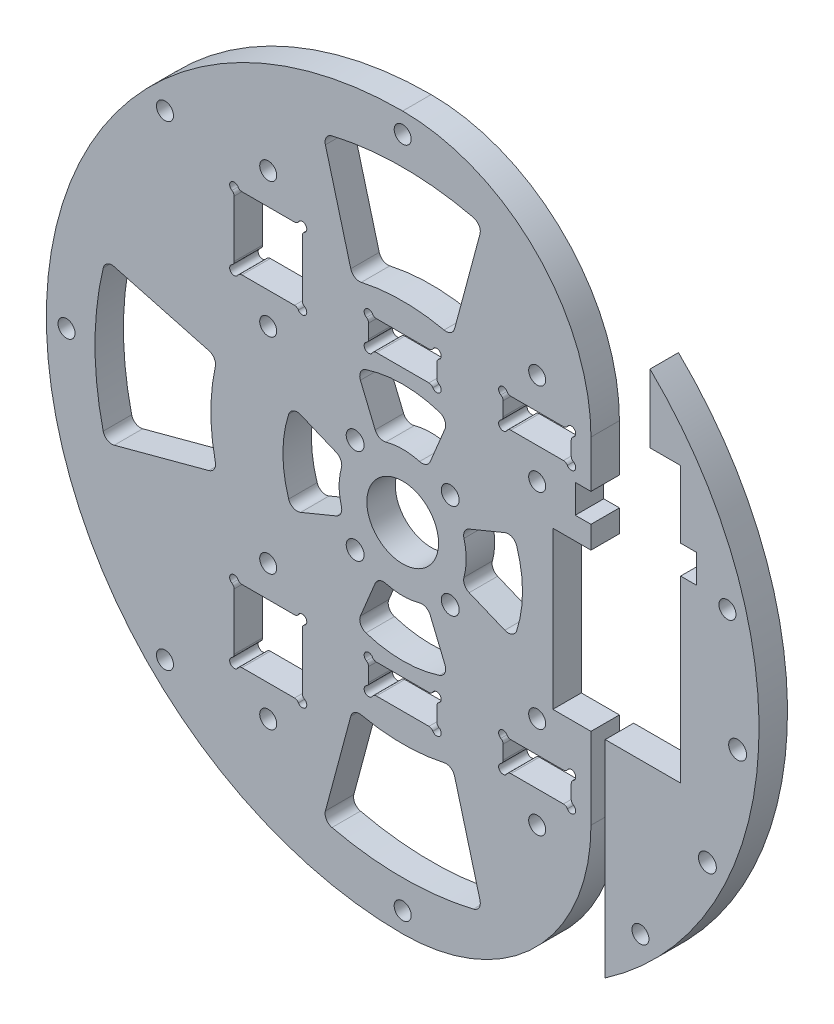
from build123d import *

# Parameters (mm, degrees)
SKETCH1_R                = 79.5
SKETCH1_R_2              = 1.9939
SKETCH1_R_3              = 1.89865
SKETCH1_R_4              = 8
BOSS_EXTRUDE1_DEPTH      = 6.35
SKETCH5_W                = 15.2
SKETCH5_H                = 16.075
CUT_EXTRUDE4_DEPTH       = 113.609158153
SKETCH6_R                = 1
CUT_EXTRUDE5_DEPTH       = 113.609158153
FILLET1_R                = 1
SKETCH10_W               = 53.523609979
SKETCH10_H               = 37.243469735
SKETCH10_W_2             = 54.285324016
SKETCH10_H_2             = 37.23416744
BOSS_EXTRUDE2_DEPTH      = 6.35
SKETCH11_W               = 15.2
SKETCH11_H               = 6.55
CUT_EXTRUDE8_DEPTH       = 113.609158153
SKETCH13_R               = 1
CUT_EXTRUDE9_DEPTH       = 113.609158153
FILLET2_R                = 1
LPATTERN3_COUNT          = 2
LPATTERN3_PITCH          = 30
FILLET2_OF_LPATTERN3_R   = 1
MIRROR3_DEPTH            = 6.35
CUT_EXTRUDE11_DEPTH      = 113.609158153
SKETCH15_W               = 6.35
SKETCH15_H               = 80
CUT_EXTRUDE12_DEPTH      = 113.609158153
CUT_EXTRUDE14_DEPTH      = 113.609158153
SKETCH17_R               = 1.89865
CUT_EXTRUDE15_DEPTH      = 113.609158153
CUT_EXTRUDE18_DEPTH      = 113.609158153
CUT_EXTRUDE19_DEPTH      = 113.609158153
FILLET4_R                = 2
CIRPATTERN1_COUNT        = 4
FILLET4_OF_CIRPATTERN1_R = 2
CUT_EXTRUDE20_DEPTH      = 113.609158153
FILLET5_R                = 2
CIRPATTERN2_COUNT        = 4
FILLET5_OF_CIRPATTERN2_R = 2


# Read off the part's stored shape, not the designer's step: Mirror3
with BuildPart() as part:
    # Sketch1 → Boss-Extrude1 (new body)
    with BuildSketch(Plane.XY):
        Circle(SKETCH1_R)
        with Locations((74.714602357, -6.536680706)):
            Circle(SKETCH1_R_2, mode=Mode.SUBTRACT)
        with Locations((72.444436972, 19.411428383)):
            Circle(SKETCH1_R_3, mode=Mode.SUBTRACT)
        Circle(SKETCH1_R_4, mode=Mode.SUBTRACT)
        with Locations((67.973084028, -31.696369631)):
            Circle(SKETCH1_R_2, mode=Mode.SUBTRACT)
        with Locations((10.606601718, -10.606601718)):
            Circle(SKETCH1_R_2, mode=Mode.SUBTRACT)
        with Locations((0, -75)):
            Circle(SKETCH1_R_3, mode=Mode.SUBTRACT)
        with Locations((-10.606601718, -10.606601718)):
            Circle(SKETCH1_R_2, mode=Mode.SUBTRACT)
        with Locations((-10.606601718, 10.606601718)):
            Circle(SKETCH1_R_2, mode=Mode.SUBTRACT)
        with Locations((10.606601718, 10.606601718)):
            Circle(SKETCH1_R_2, mode=Mode.SUBTRACT)
        with Locations((-53.033008589, -53.033008589)):
            Circle(SKETCH1_R_3, mode=Mode.SUBTRACT)
        with Locations((-75, 0)):
            Circle(SKETCH1_R_3, mode=Mode.SUBTRACT)
        with Locations((-53.033008589, 53.033008589)):
            Circle(SKETCH1_R_3, mode=Mode.SUBTRACT)
        with Locations((0, 75)):
            Circle(SKETCH1_R_3, mode=Mode.SUBTRACT)
        with Locations((53.033008589, -53.033008589)):
            Circle(SKETCH1_R_3, mode=Mode.SUBTRACT)
    extrude(amount=BOSS_EXTRUDE1_DEPTH)

    # Sketch5 → Cut-Extrude4 (cut, through all)
    with BuildSketch(Plane.XY.offset(6.35)):
        with Locations((-30, -37.9375)):
            Rectangle(SKETCH5_W, SKETCH5_H)
        with Locations((-30, 37.9375)):
            Rectangle(SKETCH5_W, SKETCH5_H)
        with Locations((30, 37.9375)):
            Rectangle(SKETCH5_W, SKETCH5_H)
        with Locations((0, -37.9375)):
            Rectangle(SKETCH5_W, SKETCH5_H)
        with Locations((30, -37.9375)):
            Rectangle(SKETCH5_W, SKETCH5_H)
        with Locations((0, 37.9375)):
            Rectangle(SKETCH5_W, SKETCH5_H)
    extrude(amount=-CUT_EXTRUDE4_DEPTH, mode=Mode.SUBTRACT)

    # Sketch6 → Cut-Extrude5 (cut, through all)
    with BuildSketch(Plane.XY.offset(6.35)):
        with Locations((-37.6, 45.975)):
            Circle(SKETCH6_R)
        with Locations((-22.4, 45.975)):
            Circle(SKETCH6_R)
        with Locations((-37.6, 29.9)):
            Circle(SKETCH6_R)
        with Locations((-22.4, 29.9)):
            Circle(SKETCH6_R)
        with Locations((-7.6, 45.975)):
            Circle(SKETCH6_R)
        with Locations((7.6, 45.975)):
            Circle(SKETCH6_R)
        with Locations((-7.6, 29.9)):
            Circle(SKETCH6_R)
        with Locations((7.6, 29.9)):
            Circle(SKETCH6_R)
        with Locations((22.4, 45.975)):
            Circle(SKETCH6_R)
        with Locations((37.6, 45.975)):
            Circle(SKETCH6_R)
        with Locations((22.4, 29.9)):
            Circle(SKETCH6_R)
        with Locations((37.6, 29.9)):
            Circle(SKETCH6_R)
        with Locations((-37.6, -29.9)):
            Circle(SKETCH6_R)
        with Locations((-22.4, -29.9)):
            Circle(SKETCH6_R)
        with Locations((-37.6, -45.975)):
            Circle(SKETCH6_R)
        with Locations((-22.4, -45.975)):
            Circle(SKETCH6_R)
        with Locations((-7.6, -29.9)):
            Circle(SKETCH6_R)
        with Locations((7.6, -29.9)):
            Circle(SKETCH6_R)
        with Locations((-7.6, -45.975)):
            Circle(SKETCH6_R)
        with Locations((7.6, -45.975)):
            Circle(SKETCH6_R)
        with Locations((22.4, -29.9)):
            Circle(SKETCH6_R)
        with Locations((37.6, -29.9)):
            Circle(SKETCH6_R)
        with Locations((22.4, -45.975)):
            Circle(SKETCH6_R)
        with Locations((37.6, -45.975)):
            Circle(SKETCH6_R)
    extrude(amount=-CUT_EXTRUDE5_DEPTH, mode=Mode.SUBTRACT)

    # Fillet1
    fillet1_edges = [part.edges().sort_by_distance(p)[0] for p in [
        (-37.6, 44.975, 3.175),
        (-36.6, 45.975, 3.175),
        (-22.4, 44.975, 3.175),
        (-23.4, 45.975, 3.175),
        (-37.6, 30.9, 3.175),
        (-36.6, 29.9, 3.175),
        (-23.4, 29.9, 3.175),
        (-22.4, 30.9, 3.175),
        (-7.6, 44.975, 3.175),
        (-6.6, 45.975, 3.175),
        (7.6, 44.975, 3.175),
        (6.6, 45.975, 3.175),
        (-7.6, 30.9, 3.175),
        (-6.6, 29.9, 3.175),
        (6.6, 29.9, 3.175),
        (7.6, 30.9, 3.175),
        (22.4, 44.975, 3.175),
        (23.4, 45.975, 3.175),
        (37.6, 44.975, 3.175),
        (36.6, 45.975, 3.175),
        (22.4, 30.9, 3.175),
        (23.4, 29.9, 3.175),
        (36.6, 29.9, 3.175),
        (37.6, 30.9, 3.175),
        (-36.6, -29.9, 3.175),
        (-37.6, -30.9, 3.175),
        (-22.4, -30.9, 3.175),
        (-23.4, -29.9, 3.175),
        (-36.6, -45.975, 3.175),
        (-37.6, -44.975, 3.175),
        (-23.4, -45.975, 3.175),
        (-22.4, -44.975, 3.175),
        (-6.6, -29.9, 3.175),
        (-7.6, -30.9, 3.175),
        (7.6, -30.9, 3.175),
        (6.6, -29.9, 3.175),
        (-6.6, -45.975, 3.175),
        (-7.6, -44.975, 3.175),
        (6.6, -45.975, 3.175),
        (7.6, -44.975, 3.175),
        (23.4, -29.9, 3.175),
        (22.4, -30.9, 3.175),
        (37.6, -30.9, 3.175),
        (36.6, -29.9, 3.175),
        (23.4, -45.975, 3.175),
        (22.4, -44.975, 3.175),
        (36.6, -45.975, 3.175),
        (37.6, -44.975, 3.175),
    ]]
    fillet(fillet1_edges, radius=FILLET1_R)

    # Sketch10 → Boss-Extrude2 (add, through all)
    with BuildSketch(Plane(origin=(0, 0, 0), x_dir=(-1, 0, 0), z_dir=(0, 0, -1))):
        with Locations((-13.786008458, 43.712822415)):
            Rectangle(SKETCH10_W, SKETCH10_H)
        with Locations((-15.177733449, -42.065637654)):
            Rectangle(SKETCH10_W_2, SKETCH10_H_2)
    extrude(amount=-BOSS_EXTRUDE2_DEPTH)

    # Sketch11 → Cut-Extrude8 (cut, through all)
    with BuildSketch(Plane(origin=(0, 0, 0), x_dir=(-1, 0, 0), z_dir=(0, 0, -1))):
        with Locations((0, 33.175)):
            Rectangle(SKETCH11_W, SKETCH11_H)
    cut_extrude8 = extrude(amount=-CUT_EXTRUDE8_DEPTH, mode=Mode.SUBTRACT)

    # Sketch13 → Cut-Extrude9 (cut, through all)
    with BuildSketch(Plane(origin=(0, 0, 0), x_dir=(-1, 0, 0), z_dir=(0, 0, -1))):
        with Locations((-7.6, 36.45)):
            Circle(SKETCH13_R)
        with Locations((-7.6, 29.9)):
            Circle(SKETCH13_R)
        with Locations((7.6, 29.9)):
            Circle(SKETCH13_R)
        with Locations((7.6, 36.45)):
            Circle(SKETCH13_R)
    cut_extrude9 = extrude(amount=-CUT_EXTRUDE9_DEPTH, mode=Mode.SUBTRACT)

    # Fillet2
    fillet2_edges = [part.edges().sort_by_distance(p)[0] for p in [
        (6.6, 36.45, 3.175),
        (7.6, 35.45, 3.175),
        (-6.6, 36.45, 3.175),
        (7.6, 30.9, 3.175),
        (-6.6, 29.9, 3.175),
        (6.6, 29.9, 3.175),
        (-7.6, 30.9, 3.175),
        (-7.6, 35.45, 3.175),
    ]]
    fillet(fillet2_edges, radius=FILLET2_R)

    # LPattern3: Cut-Extrude8, Cut-Extrude9 ×2
    with Locations(*[(i * LPATTERN3_PITCH, 0, 0) for i in range(1, LPATTERN3_COUNT)]):
        add(cut_extrude8, mode=Mode.SUBTRACT)
        add(cut_extrude9, mode=Mode.SUBTRACT)

    # Fillet2 of LPattern3
    fillet2_of_lpattern3_edges = [part.edges().sort_by_distance(p)[0] for p in [
        (36.6, 36.45, 3.175),
        (37.6, 35.45, 3.175),
        (23.4, 36.45, 3.175),
        (37.6, 30.9, 3.175),
        (23.4, 29.9, 3.175),
        (36.6, 29.9, 3.175),
        (22.4, 30.9, 3.175),
        (22.4, 35.45, 3.175),
    ]]
    fillet(fillet2_of_lpattern3_edges, radius=FILLET2_OF_LPATTERN3_R)

    # Mirror3 outline → Mirror3 (cut)
    with BuildSketch(Plane.XY):
        with BuildLine():
            Line((-5.867949192, -36.45), (5.867949192, -36.45))
            ThreePointArc((5.867949192, -36.45), (6.367949192, -36.583974596), (6.733974596, -36.95))
            ThreePointArc((6.733974596, -36.95), (8.307106781, -37.157106781), (8.1, -35.583974596))
            ThreePointArc((8.1, -35.583974596), (7.733974596, -35.217949192), (7.6, -34.717949192))
            Line((7.6, -34.717949192), (7.6, -31.632050808))
            ThreePointArc((7.6, -31.632050808), (7.733974596, -31.132050808), (8.1, -30.766025404))
            ThreePointArc((8.1, -30.766025404), (8.307106781, -29.192893219), (6.733974596, -29.4))
            ThreePointArc((6.733974596, -29.4), (6.367949192, -29.766025404), (5.867949192, -29.9))
            Line((5.867949192, -29.9), (-5.867949192, -29.9))
            ThreePointArc((-5.867949192, -29.9), (-6.367949192, -29.766025404), (-6.733974596, -29.4))
            ThreePointArc((-6.733974596, -29.4), (-8.307106781, -29.192893219), (-8.1, -30.766025404))
            ThreePointArc((-8.1, -30.766025404), (-7.733974596, -31.132050808), (-7.6, -31.632050808))
            Line((-7.6, -31.632050808), (-7.6, -34.717949192))
            ThreePointArc((-7.6, -34.717949192), (-7.733974596, -35.217949192), (-8.1, -35.583974596))
            ThreePointArc((-8.1, -35.583974596), (-8.307106781, -37.157106781), (-6.733974596, -36.95))
            ThreePointArc((-6.733974596, -36.95), (-6.367949192, -36.583974596), (-5.867949192, -36.45))
        make_face()
        with BuildLine():
            Line((24.132050808, -36.45), (35.867949192, -36.45))
            ThreePointArc((35.867949192, -36.45), (36.367949192, -36.583974596), (36.733974596, -36.95))
            ThreePointArc((36.733974596, -36.95), (38.307106781, -37.157106781), (38.1, -35.583974596))
            ThreePointArc((38.1, -35.583974596), (37.733974596, -35.217949192), (37.6, -34.717949192))
            Line((37.6, -34.717949192), (37.6, -31.632050808))
            ThreePointArc((37.6, -31.632050808), (37.733974596, -31.132050808), (38.1, -30.766025404))
            ThreePointArc((38.1, -30.766025404), (38.307106781, -29.192893219), (36.733974596, -29.4))
            ThreePointArc((36.733974596, -29.4), (36.367949192, -29.766025404), (35.867949192, -29.9))
            Line((35.867949192, -29.9), (24.132050808, -29.9))
            ThreePointArc((24.132050808, -29.9), (23.632050808, -29.766025404), (23.266025404, -29.4))
            ThreePointArc((23.266025404, -29.4), (21.692893219, -29.192893219), (21.9, -30.766025404))
            ThreePointArc((21.9, -30.766025404), (22.266025404, -31.132050808), (22.4, -31.632050808))
            Line((22.4, -31.632050808), (22.4, -34.717949192))
            ThreePointArc((22.4, -34.717949192), (22.266025404, -35.217949192), (21.9, -35.583974596))
            ThreePointArc((21.9, -35.583974596), (21.692893219, -37.157106781), (23.266025404, -36.95))
            ThreePointArc((23.266025404, -36.95), (23.632050808, -36.583974596), (24.132050808, -36.45))
        make_face()
    extrude(amount=MIRROR3_DEPTH, mode=Mode.SUBTRACT)

    # Sketch14 → Cut-Extrude11 (cut, through all)
    with BuildSketch(Plane.XY):
        Polygon((33.5, -19.35), (62, -19.35), (62, 20.65), (65.5, 20.65), (65.5, 27), (62, 27), (62, 42), (42, 42), (42, 27), (38.5, 27), (38.5, 20.65), (42, 20.65), (42, 15.65), (33.5, 15.65), align=None)
    extrude(amount=CUT_EXTRUDE11_DEPTH, mode=Mode.SUBTRACT)

    # Sketch15 → Cut-Extrude12 (cut, through all)
    with BuildSketch(Plane.XY.offset(6.35)):
        with Locations((52, 42)):
            Rectangle(SKETCH15_W, SKETCH15_H)
    extrude(amount=-CUT_EXTRUDE12_DEPTH, mode=Mode.SUBTRACT)

    # Sketch16 → Cut-Extrude14 (cut, through all)
    with BuildSketch(Plane.XY):
        with BuildLine():
            Line((42, -37.5), (42, -14.02059918))
            Line((42, -14.02059918), (45.175, -14.029540215))
            Line((45.175, -14.029540215), (45.175, -79.5))
            Line((45.175, -79.5), (0, -79.5))
            ThreePointArc((0, -79.5), (29.69848481, -67.19848481), (42, -37.5))
        make_face()
        with BuildLine():
            Line((0, 79.5), (45.175, 79.5))
            Line((45.175, 79.5), (45.175, 14.029540215))
            Line((45.175, 14.029540215), (42, 14.02059918))
            Line((42, 14.02059918), (42, 37.5))
            ThreePointArc((42, 37.5), (29.69848481, 67.19848481), (0, 79.5))
        make_face()
    extrude(amount=CUT_EXTRUDE14_DEPTH, mode=Mode.SUBTRACT)


with BuildPart() as cut_extrude14_piece_1:
    # of the separate pieces the step leaves, piece 1, a body of its own (cut_extrude14_pieces)
    add(part.part.solids().sort_by_distance((0, 79.5, 6.35))[0])

    # Sketch17 → Cut-Extrude15 (cut, through all)
    with BuildSketch(Plane.XY.offset(6.35)):
        with Locations((-30, 52.975)):
            Circle(SKETCH17_R)
        with Locations((-30, 22.9)):
            Circle(SKETCH17_R)
        with Locations((30, 22.9)):
            Circle(SKETCH17_R)
        with Locations((30, 43.45)):
            Circle(SKETCH17_R)
    cut_extrude15 = extrude(amount=-CUT_EXTRUDE15_DEPTH, mode=Mode.SUBTRACT)

    # Mirror4: Cut-Extrude15 across plane
    add(cut_extrude15.mirror(Plane.ZX), mode=Mode.SUBTRACT)

    # Sketch25 → Cut-Extrude19 (cut, through all)
    with BuildSketch(Plane.XY.offset(6.35)):
        with BuildLine():
            Line((-10.22721473, -24.690680506), (-5.424537654, -13.095992373))
            ThreePointArc((-5.424537654, -13.095992373), (0, -14.175), (5.424537654, -13.095992373))
            Line((5.424537654, -13.095992373), (10.22721473, -24.690680506))
            ThreePointArc((10.22721473, -24.690680506), (0, -26.725), (-10.22721473, -24.690680506))
        make_face()
    cut_extrude19 = extrude(amount=-CUT_EXTRUDE19_DEPTH, mode=Mode.SUBTRACT)

    # Fillet4
    fillet4_edges = [cut_extrude14_piece_1.edges().sort_by_distance(p)[0] for p in [
        (-5.424537654, -13.095992373, 3.175),
        (5.424537654, -13.095992373, 3.175),
        (10.22721473, -24.690680506, 3.175),
        (-10.22721473, -24.690680506, 3.175),
    ]]
    fillet(fillet4_edges, radius=FILLET4_R)

    # CirPattern1: Cut-Extrude19 ×4 about axis
    cirpattern1_axis = Axis((0, 0, 0), (0, 0, 1))
    for i in range(1, CIRPATTERN1_COUNT):
        add(cut_extrude19.rotate(cirpattern1_axis, i * 360 / CIRPATTERN1_COUNT), mode=Mode.SUBTRACT)

    # Fillet4 of CirPattern1
    fillet4_of_cirpattern1_edges = [cut_extrude14_piece_1.edges().sort_by_distance(p)[0] for p in [
        (13.095992373, -5.424537654, 3.175),
        (13.095992373, 5.424537654, 3.175),
        (24.690680506, 10.22721473, 3.175),
        (24.690680506, -10.22721473, 3.175),
        (5.424537654, 13.095992373, 3.175),
        (-5.424537654, 13.095992373, 3.175),
        (-10.22721473, 24.690680506, 3.175),
        (10.22721473, 24.690680506, 3.175),
        (-13.095992373, 5.424537654, 3.175),
        (-13.095992373, -5.424537654, 3.175),
        (-24.690680506, -10.22721473, 3.175),
        (-24.690680506, 10.22721473, 3.175),
    ]]
    fillet(fillet4_of_cirpattern1_edges, radius=FILLET4_OF_CIRPATTERN1_R)

    # Sketch26 → Cut-Extrude20 (cut, through all)
    with BuildSketch(Plane.XY.offset(6.35)):
        with BuildLine():
            Line((-17.767927446, -66.310807975), (-11.07745513, -41.341625365))
            ThreePointArc((-11.07745513, -41.341625365), (0, -42.8), (11.07745513, -41.341625365))
            Line((11.07745513, -41.341625365), (17.767927446, -66.310807975))
            ThreePointArc((17.767927446, -66.310807975), (0, -68.65), (-17.767927446, -66.310807975))
        make_face()
    cut_extrude20 = extrude(amount=-CUT_EXTRUDE20_DEPTH, mode=Mode.SUBTRACT)

    # Fillet5
    fillet5_edges = [cut_extrude14_piece_1.edges().sort_by_distance(p)[0] for p in [
        (-11.07745513, -41.341625365, 3.175),
        (11.07745513, -41.341625365, 3.175),
        (17.767927446, -66.310807975, 3.175),
        (-17.767927446, -66.310807975, 3.175),
    ]]
    fillet(fillet5_edges, radius=FILLET5_R)

    # CirPattern2: Cut-Extrude20 ×4 about axis, 1 skipped
    cirpattern2_axis = Axis((0, 0, 0), (0, 0, -1))
    add([cut_extrude20.rotate(cirpattern2_axis, i * 360 / CIRPATTERN2_COUNT) for i in range(1, CIRPATTERN2_COUNT) if i not in (3,)], mode=Mode.SUBTRACT)

    # Fillet5 of CirPattern2
    fillet5_of_cirpattern2_edges = [cut_extrude14_piece_1.edges().sort_by_distance(p)[0] for p in [
        (-41.341625365, 11.07745513, 3.175),
        (-41.341625365, -11.07745513, 3.175),
        (-66.310807975, -17.767927446, 3.175),
        (-66.310807975, 17.767927446, 3.175),
        (11.07745513, 41.341625365, 3.175),
        (-11.07745513, 41.341625365, 3.175),
        (-17.767927446, 66.310807975, 3.175),
        (17.767927446, 66.310807975, 3.175),
    ]]
    fillet(fillet5_of_cirpattern2_edges, radius=FILLET5_OF_CIRPATTERN2_R)


with BuildPart() as cut_extrude14_piece_2:
    # of the separate pieces the step leaves, piece 2, a body of its own (cut_extrude14_pieces)
    add(part.part.solids().sort_by_distance((45.175, -65.41765339, 6.35))[0])


with BuildPart() as cut_extrude14_piece_3:
    # of the separate pieces the step leaves, piece 3, a body of its own (cut_extrude14_pieces)
    add(part.part.solids().sort_by_distance((48.825, 62.740492308, 6.35))[0])

    # Sketch24 → Cut-Extrude18 (cut, through all)
    with BuildSketch(Plane.XY.offset(6.35)):
        with BuildLine():
            Line((45.175, 65.41765339), (45.175, 42))
            Line((45.175, 42), (48.825, 42))
            Line((48.825, 42), (48.825, 62.740492308))
            ThreePointArc((48.825, 62.740492308), (47.019057816, 64.10505598), (45.175, 65.41765339))
        make_face()
    extrude(amount=-CUT_EXTRUDE18_DEPTH, mode=Mode.SUBTRACT)


solid = Compound([cut_extrude14_piece_1.part, cut_extrude14_piece_2.part])
